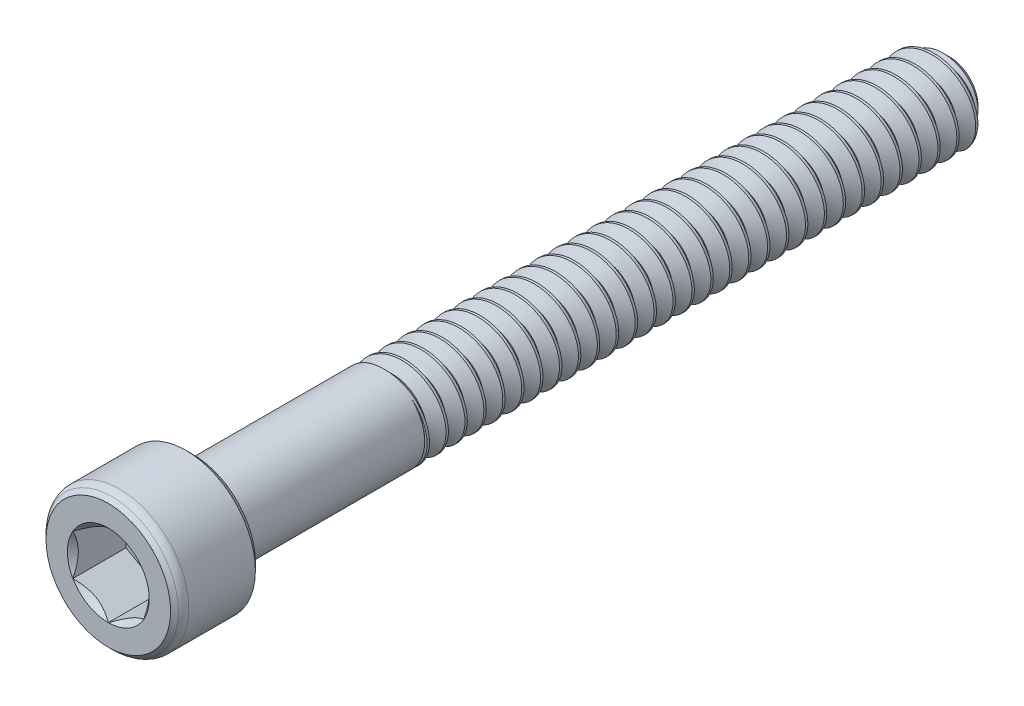
from build123d import *

# Parameters (mm, degrees)
CHAMFER1_SIZE      = 0.23241
FILLET1_R          = 0.348615
CHAMFER2_SIZE      = 0.47625
CUT_EXTRUDE1_DEPTH = 1.7859375
CUT_SWEEP1_PITCH   = 0.635
CUT_SWEEP1_TO      = 19.05


with BuildPart() as part:
    # Sketch3 → Revolve1 (revolve)
    with BuildSketch(Plane(origin=(0, 0, 0), x_dir=(0, 0, -1), z_dir=(1, 0, 0)), mode=Mode.PRIVATE) as revolve1_sk:
        Polygon((-14.1224, 0), (14.1224, 0), (14.1224, 1.4224), (-11.2776, 1.4224), (-11.2776, 2.3241), (-14.1224, 2.3241), align=None)
    revolve(revolve1_sk.sketch.rotate(Axis((0, 0, 14.1224), (0, 0, -1)), 90), axis=Axis((0, 0, 14.1224), (0, 0, -1)))

    # Chamfer1
    chamfer1_edges = [part.edges().sort_by_distance(p)[0] for p in [
        (-2.3241, 0, 11.2776),
        (-2.3241, 0, 14.1224),
    ]]
    chamfer(chamfer1_edges, length=CHAMFER1_SIZE)

    # Fillet1
    fillet1_edges = [part.edges().sort_by_distance(p)[0] for p in [
        (-2.3241, 0, 13.88999),
    ]]
    fillet(fillet1_edges, radius=FILLET1_R)

    # Chamfer2
    chamfer2_edges = [part.edges().sort_by_distance(p)[0] for p in [
        (-1.4224, 0, -14.1224),
    ]]
    chamfer(chamfer2_edges, length=CHAMFER2_SIZE)

    # Sketch4 → Cut-Extrude1 (cut)
    with BuildSketch(Plane.XY.offset(14.1224)):
        Polygon((-1.190625, -0.687407664), (0, -1.374815329), (1.190625, -0.687407664), (1.190625, 0.687407664), (0, 1.374815329), (-1.190625, 0.687407664), align=None)
    extrude(amount=-CUT_EXTRUDE1_DEPTH, mode=Mode.SUBTRACT)

    # Cut-Extrude2 cone 1 section (through the dimple's axis) → Cut-Extrude2 (revolve, cut)
    with BuildSketch(Plane(origin=(0, 0, 14.1224), x_dir=(0, -1, 0), z_dir=(1, 0, 0))):
        Polygon((0, 0), (1.374815329, 0), (0, 1.374815329), align=None)
    revolve(axis=Axis((0, 0, 14.1224), (0, 0, -1)), mode=Mode.SUBTRACT)


with BuildPart() as body_2:
    # Split1: the piece on the far side of the plane
    add(part.part)
    split(bisect_by=Plane(origin=(0, 0, 4.9276), x_dir=(-1, 0, 0), z_dir=(0, 0, -1)), keep=Keep.BOTTOM)


with BuildPart() as part_1:
    add(part.part)

    # Split1
    split(bisect_by=Plane(origin=(0, 0, 4.9276), x_dir=(-1, 0, 0), z_dir=(0, 0, -1)), keep=Keep.TOP)

    # Cut-Sweep1: arcs per turn and ends read off the stored shape
    # Cut-Sweep1: the profile of Sketch7 profile screwed along a right-hand helix through 31 turns, 6 arcs to a turn; built about Z, then put on its axis
    cut_sweep1_z = Axis((0, 0, 0), (0, 0, 1))
    cut_sweep1_corners = [(1.4227, 0, 0.000173205), (1.4227, 0, -0.555798205), (1.009955401, 0, -0.3175), (1.009955401, 0, -0.238125)]
    with BuildLine(mode=Mode.PRIVATE) as cut_sweep1_profile:
        Line(cut_sweep1_corners[0], cut_sweep1_corners[1])
        Line(cut_sweep1_corners[1], cut_sweep1_corners[2])
        Line(cut_sweep1_corners[2], cut_sweep1_corners[3])
        Line(cut_sweep1_corners[3], cut_sweep1_corners[0])
    cut_sweep1_cap = Face(cut_sweep1_profile.wire())
    cut_sweep1_turn_angles = [0, 30, 60, 90, 120, 150, 180, 210, 240, 270, 300, 330, 360]
    cut_sweep1_turn_weights = [1, 0.8660254037844387, 1, 0.8660254037844387, 1, 0.8660254037844387, 1, 0.8660254037844387, 1, 0.8660254037844387, 1, 0.8660254037844387, 1]
    cut_sweep1_turn_rails = [Edge.make_bspline([Vector(p[0], p[1], 0).rotate(cut_sweep1_z, cut_sweep1_turn_angles[k]) / cut_sweep1_turn_weights[k] + Vector(0, 0, p[2] + CUT_SWEEP1_PITCH * cut_sweep1_turn_angles[k] / 360) for k in range(13)], [0, 0, 0, 1, 1, 2, 2, 3, 3, 4, 4, 5, 5, 6, 6, 6], 2, cut_sweep1_turn_weights) for p in cut_sweep1_corners]
    cut_sweep1_turn_sides = [Face.make_surface_from_curves(cut_sweep1_turn_rails[p[0]], cut_sweep1_turn_rails[p[1]]) for p in [(0, 1), (1, 2), (2, 3), (3, 0)]]
    cut_sweep1 = Plane(origin=(0, 0, -14.1224), x_dir=(0, 1, 0), z_dir=(0, 0, 1)) * split(Solid(Shell([*[p.moved(Location((0, 0, CUT_SWEEP1_PITCH * i))) for i in range(31) for p in cut_sweep1_turn_sides], cut_sweep1_cap, cut_sweep1_cap.rotate(cut_sweep1_z, 11160).moved(Location((0, 0, CUT_SWEEP1_PITCH * 11160 / 360)))])), bisect_by=Plane.XY.offset(CUT_SWEEP1_TO), keep=Keep.BOTTOM, mode=Mode.PRIVATE)
    add(cut_sweep1, mode=Mode.SUBTRACT)

    # Combine1: union body 2
    add(body_2.part)

    # Boss-Extrude1 cone 1 section (through the dimple's axis) → Boss-Extrude1 (revolve)
    with BuildSketch(Plane(origin=(0, 0, 4.9276), x_dir=(0, -1, 0), z_dir=(1, 0, 0))):
        Polygon((0, 0), (1.4224, 0), (0, 1.4224), align=None)
    revolve(axis=Axis((0, 0, 4.9276), (0, 0, -1)))


solid = part_1.part
